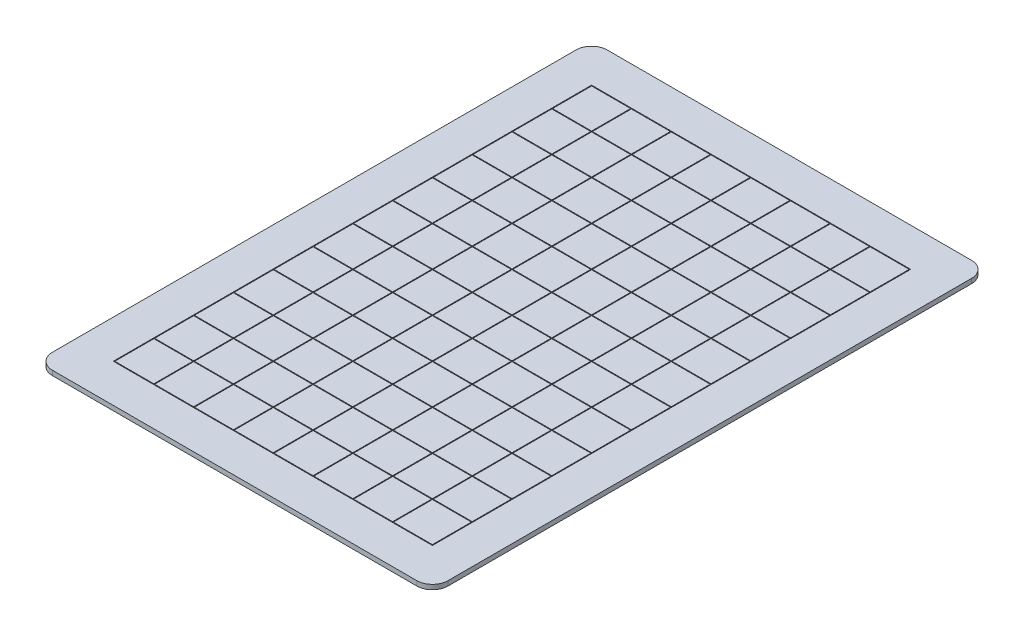
from build123d import *

# Parameters (mm, degrees)
SKETCH1_W           = 253.5
SKETCH1_H           = 355.5
BOSS_EXTRUDE1_DEPTH = 3
SKETCH2_W           = 204.5
SKETCH2_H           = 306.5
SKETCH2_W_2         = 25
SKETCH2_H_2         = 25
CUT_EXTRUDE1_DEPTH  = 0.5
SKETCH4_R           = 1.6
CUT_EXTRUDE2_DEPTH  = 1.2
FILLET1_R           = 10


with BuildPart() as part:
    # Sketch1 → Boss-Extrude1 (new body)
    with BuildSketch(Plane(origin=(0, 0, 0), x_dir=(1, 0, 0), z_dir=(0, 1, 0))):
        with Locations((126.75, 177.75)):
            Rectangle(SKETCH1_W, SKETCH1_H)
    extrude(amount=BOSS_EXTRUDE1_DEPTH)

    # Sketch2 → Cut-Extrude1 (cut)
    with BuildSketch(Plane(origin=(0, 3, 0), x_dir=(1, 0, 0), z_dir=(0, 1, 0))):
        with Locations((126.75, 177.75)):
            Rectangle(SKETCH2_W, SKETCH2_H)
        with Locations((37.5, 37.5)):
            Rectangle(SKETCH2_W_2, SKETCH2_H_2, mode=Mode.SUBTRACT)
        with Locations((63, 37.5)):
            Rectangle(SKETCH2_W_2, SKETCH2_H_2, mode=Mode.SUBTRACT)
        with Locations((88.5, 37.5)):
            Rectangle(SKETCH2_W_2, SKETCH2_H_2, mode=Mode.SUBTRACT)
        with Locations((114, 37.5)):
            Rectangle(SKETCH2_W_2, SKETCH2_H_2, mode=Mode.SUBTRACT)
        with Locations((139.5, 37.5)):
            Rectangle(SKETCH2_W_2, SKETCH2_H_2, mode=Mode.SUBTRACT)
        with Locations((165, 37.5)):
            Rectangle(SKETCH2_W_2, SKETCH2_H_2, mode=Mode.SUBTRACT)
        with Locations((190.5, 37.5)):
            Rectangle(SKETCH2_W_2, SKETCH2_H_2, mode=Mode.SUBTRACT)
        with Locations((216, 37.5)):
            Rectangle(SKETCH2_W_2, SKETCH2_H_2, mode=Mode.SUBTRACT)
        with Locations((63, 63)):
            Rectangle(SKETCH2_W_2, SKETCH2_H_2, mode=Mode.SUBTRACT)
        with Locations((88.5, 63)):
            Rectangle(SKETCH2_W_2, SKETCH2_H_2, mode=Mode.SUBTRACT)
        with Locations((114, 63)):
            Rectangle(SKETCH2_W_2, SKETCH2_H_2, mode=Mode.SUBTRACT)
        with Locations((139.5, 63)):
            Rectangle(SKETCH2_W_2, SKETCH2_H_2, mode=Mode.SUBTRACT)
        with Locations((165, 63)):
            Rectangle(SKETCH2_W_2, SKETCH2_H_2, mode=Mode.SUBTRACT)
        with Locations((190.5, 63)):
            Rectangle(SKETCH2_W_2, SKETCH2_H_2, mode=Mode.SUBTRACT)
        with Locations((216, 63)):
            Rectangle(SKETCH2_W_2, SKETCH2_H_2, mode=Mode.SUBTRACT)
        with Locations((63, 88.5)):
            Rectangle(SKETCH2_W_2, SKETCH2_H_2, mode=Mode.SUBTRACT)
        with Locations((88.5, 88.5)):
            Rectangle(SKETCH2_W_2, SKETCH2_H_2, mode=Mode.SUBTRACT)
        with Locations((114, 88.5)):
            Rectangle(SKETCH2_W_2, SKETCH2_H_2, mode=Mode.SUBTRACT)
        with Locations((139.5, 88.5)):
            Rectangle(SKETCH2_W_2, SKETCH2_H_2, mode=Mode.SUBTRACT)
        with Locations((165, 88.5)):
            Rectangle(SKETCH2_W_2, SKETCH2_H_2, mode=Mode.SUBTRACT)
        with Locations((190.5, 88.5)):
            Rectangle(SKETCH2_W_2, SKETCH2_H_2, mode=Mode.SUBTRACT)
        with Locations((216, 88.5)):
            Rectangle(SKETCH2_W_2, SKETCH2_H_2, mode=Mode.SUBTRACT)
        with Locations((63, 114)):
            Rectangle(SKETCH2_W_2, SKETCH2_H_2, mode=Mode.SUBTRACT)
        with Locations((88.5, 114)):
            Rectangle(SKETCH2_W_2, SKETCH2_H_2, mode=Mode.SUBTRACT)
        with Locations((114, 114)):
            Rectangle(SKETCH2_W_2, SKETCH2_H_2, mode=Mode.SUBTRACT)
        with Locations((139.5, 114)):
            Rectangle(SKETCH2_W_2, SKETCH2_H_2, mode=Mode.SUBTRACT)
        with Locations((165, 114)):
            Rectangle(SKETCH2_W_2, SKETCH2_H_2, mode=Mode.SUBTRACT)
        with Locations((190.5, 114)):
            Rectangle(SKETCH2_W_2, SKETCH2_H_2, mode=Mode.SUBTRACT)
        with Locations((216, 114)):
            Rectangle(SKETCH2_W_2, SKETCH2_H_2, mode=Mode.SUBTRACT)
        with Locations((63, 139.5)):
            Rectangle(SKETCH2_W_2, SKETCH2_H_2, mode=Mode.SUBTRACT)
        with Locations((88.5, 139.5)):
            Rectangle(SKETCH2_W_2, SKETCH2_H_2, mode=Mode.SUBTRACT)
        with Locations((114, 139.5)):
            Rectangle(SKETCH2_W_2, SKETCH2_H_2, mode=Mode.SUBTRACT)
        with Locations((139.5, 139.5)):
            Rectangle(SKETCH2_W_2, SKETCH2_H_2, mode=Mode.SUBTRACT)
        with Locations((165, 139.5)):
            Rectangle(SKETCH2_W_2, SKETCH2_H_2, mode=Mode.SUBTRACT)
        with Locations((190.5, 139.5)):
            Rectangle(SKETCH2_W_2, SKETCH2_H_2, mode=Mode.SUBTRACT)
        with Locations((216, 139.5)):
            Rectangle(SKETCH2_W_2, SKETCH2_H_2, mode=Mode.SUBTRACT)
        with Locations((63, 165)):
            Rectangle(SKETCH2_W_2, SKETCH2_H_2, mode=Mode.SUBTRACT)
        with Locations((88.5, 165)):
            Rectangle(SKETCH2_W_2, SKETCH2_H_2, mode=Mode.SUBTRACT)
        with Locations((114, 165)):
            Rectangle(SKETCH2_W_2, SKETCH2_H_2, mode=Mode.SUBTRACT)
        with Locations((139.5, 165)):
            Rectangle(SKETCH2_W_2, SKETCH2_H_2, mode=Mode.SUBTRACT)
        with Locations((165, 165)):
            Rectangle(SKETCH2_W_2, SKETCH2_H_2, mode=Mode.SUBTRACT)
        with Locations((190.5, 165)):
            Rectangle(SKETCH2_W_2, SKETCH2_H_2, mode=Mode.SUBTRACT)
        with Locations((216, 165)):
            Rectangle(SKETCH2_W_2, SKETCH2_H_2, mode=Mode.SUBTRACT)
        with Locations((63, 190.5)):
            Rectangle(SKETCH2_W_2, SKETCH2_H_2, mode=Mode.SUBTRACT)
        with Locations((88.5, 190.5)):
            Rectangle(SKETCH2_W_2, SKETCH2_H_2, mode=Mode.SUBTRACT)
        with Locations((114, 190.5)):
            Rectangle(SKETCH2_W_2, SKETCH2_H_2, mode=Mode.SUBTRACT)
        with Locations((139.5, 190.5)):
            Rectangle(SKETCH2_W_2, SKETCH2_H_2, mode=Mode.SUBTRACT)
        with Locations((165, 190.5)):
            Rectangle(SKETCH2_W_2, SKETCH2_H_2, mode=Mode.SUBTRACT)
        with Locations((190.5, 190.5)):
            Rectangle(SKETCH2_W_2, SKETCH2_H_2, mode=Mode.SUBTRACT)
        with Locations((216, 190.5)):
            Rectangle(SKETCH2_W_2, SKETCH2_H_2, mode=Mode.SUBTRACT)
        with Locations((63, 216)):
            Rectangle(SKETCH2_W_2, SKETCH2_H_2, mode=Mode.SUBTRACT)
        with Locations((88.5, 216)):
            Rectangle(SKETCH2_W_2, SKETCH2_H_2, mode=Mode.SUBTRACT)
        with Locations((114, 216)):
            Rectangle(SKETCH2_W_2, SKETCH2_H_2, mode=Mode.SUBTRACT)
        with Locations((139.5, 216)):
            Rectangle(SKETCH2_W_2, SKETCH2_H_2, mode=Mode.SUBTRACT)
        with Locations((165, 216)):
            Rectangle(SKETCH2_W_2, SKETCH2_H_2, mode=Mode.SUBTRACT)
        with Locations((190.5, 216)):
            Rectangle(SKETCH2_W_2, SKETCH2_H_2, mode=Mode.SUBTRACT)
        with Locations((216, 216)):
            Rectangle(SKETCH2_W_2, SKETCH2_H_2, mode=Mode.SUBTRACT)
        with Locations((63, 241.5)):
            Rectangle(SKETCH2_W_2, SKETCH2_H_2, mode=Mode.SUBTRACT)
        with Locations((88.5, 241.5)):
            Rectangle(SKETCH2_W_2, SKETCH2_H_2, mode=Mode.SUBTRACT)
        with Locations((114, 241.5)):
            Rectangle(SKETCH2_W_2, SKETCH2_H_2, mode=Mode.SUBTRACT)
        with Locations((139.5, 241.5)):
            Rectangle(SKETCH2_W_2, SKETCH2_H_2, mode=Mode.SUBTRACT)
        with Locations((165, 241.5)):
            Rectangle(SKETCH2_W_2, SKETCH2_H_2, mode=Mode.SUBTRACT)
        with Locations((190.5, 241.5)):
            Rectangle(SKETCH2_W_2, SKETCH2_H_2, mode=Mode.SUBTRACT)
        with Locations((216, 241.5)):
            Rectangle(SKETCH2_W_2, SKETCH2_H_2, mode=Mode.SUBTRACT)
        with Locations((63, 267)):
            Rectangle(SKETCH2_W_2, SKETCH2_H_2, mode=Mode.SUBTRACT)
        with Locations((88.5, 267)):
            Rectangle(SKETCH2_W_2, SKETCH2_H_2, mode=Mode.SUBTRACT)
        with Locations((114, 267)):
            Rectangle(SKETCH2_W_2, SKETCH2_H_2, mode=Mode.SUBTRACT)
        with Locations((139.5, 267)):
            Rectangle(SKETCH2_W_2, SKETCH2_H_2, mode=Mode.SUBTRACT)
        with Locations((165, 267)):
            Rectangle(SKETCH2_W_2, SKETCH2_H_2, mode=Mode.SUBTRACT)
        with Locations((190.5, 267)):
            Rectangle(SKETCH2_W_2, SKETCH2_H_2, mode=Mode.SUBTRACT)
        with Locations((216, 267)):
            Rectangle(SKETCH2_W_2, SKETCH2_H_2, mode=Mode.SUBTRACT)
        with Locations((63, 292.5)):
            Rectangle(SKETCH2_W_2, SKETCH2_H_2, mode=Mode.SUBTRACT)
        with Locations((88.5, 292.5)):
            Rectangle(SKETCH2_W_2, SKETCH2_H_2, mode=Mode.SUBTRACT)
        with Locations((114, 292.5)):
            Rectangle(SKETCH2_W_2, SKETCH2_H_2, mode=Mode.SUBTRACT)
        with Locations((139.5, 292.5)):
            Rectangle(SKETCH2_W_2, SKETCH2_H_2, mode=Mode.SUBTRACT)
        with Locations((165, 292.5)):
            Rectangle(SKETCH2_W_2, SKETCH2_H_2, mode=Mode.SUBTRACT)
        with Locations((190.5, 292.5)):
            Rectangle(SKETCH2_W_2, SKETCH2_H_2, mode=Mode.SUBTRACT)
        with Locations((216, 292.5)):
            Rectangle(SKETCH2_W_2, SKETCH2_H_2, mode=Mode.SUBTRACT)
        with Locations((63, 318)):
            Rectangle(SKETCH2_W_2, SKETCH2_H_2, mode=Mode.SUBTRACT)
        with Locations((88.5, 318)):
            Rectangle(SKETCH2_W_2, SKETCH2_H_2, mode=Mode.SUBTRACT)
        with Locations((114, 318)):
            Rectangle(SKETCH2_W_2, SKETCH2_H_2, mode=Mode.SUBTRACT)
        with Locations((139.5, 318)):
            Rectangle(SKETCH2_W_2, SKETCH2_H_2, mode=Mode.SUBTRACT)
        with Locations((165, 318)):
            Rectangle(SKETCH2_W_2, SKETCH2_H_2, mode=Mode.SUBTRACT)
        with Locations((190.5, 318)):
            Rectangle(SKETCH2_W_2, SKETCH2_H_2, mode=Mode.SUBTRACT)
        with Locations((216, 318)):
            Rectangle(SKETCH2_W_2, SKETCH2_H_2, mode=Mode.SUBTRACT)
        with Locations((37.5, 63)):
            Rectangle(SKETCH2_W_2, SKETCH2_H_2, mode=Mode.SUBTRACT)
        with Locations((37.5, 88.5)):
            Rectangle(SKETCH2_W_2, SKETCH2_H_2, mode=Mode.SUBTRACT)
        with Locations((37.5, 114)):
            Rectangle(SKETCH2_W_2, SKETCH2_H_2, mode=Mode.SUBTRACT)
        with Locations((37.5, 139.5)):
            Rectangle(SKETCH2_W_2, SKETCH2_H_2, mode=Mode.SUBTRACT)
        with Locations((37.5, 165)):
            Rectangle(SKETCH2_W_2, SKETCH2_H_2, mode=Mode.SUBTRACT)
        with Locations((37.5, 190.5)):
            Rectangle(SKETCH2_W_2, SKETCH2_H_2, mode=Mode.SUBTRACT)
        with Locations((37.5, 216)):
            Rectangle(SKETCH2_W_2, SKETCH2_H_2, mode=Mode.SUBTRACT)
        with Locations((37.5, 241.5)):
            Rectangle(SKETCH2_W_2, SKETCH2_H_2, mode=Mode.SUBTRACT)
        with Locations((37.5, 267)):
            Rectangle(SKETCH2_W_2, SKETCH2_H_2, mode=Mode.SUBTRACT)
        with Locations((37.5, 292.5)):
            Rectangle(SKETCH2_W_2, SKETCH2_H_2, mode=Mode.SUBTRACT)
        with Locations((37.5, 318)):
            Rectangle(SKETCH2_W_2, SKETCH2_H_2, mode=Mode.SUBTRACT)
    extrude(amount=-CUT_EXTRUDE1_DEPTH, mode=Mode.SUBTRACT)

    # Sketch4 → Cut-Extrude2 (cut)
    with BuildSketch(Plane.XZ):
        with Locations((6, -177.75)):
            Circle(SKETCH4_R)
        with Locations((247.5, -177.75)):
            Circle(SKETCH4_R)
        with Locations((6, -6)):
            Circle(SKETCH4_R)
        with Locations((6, -91.875)):
            Circle(SKETCH4_R)
        with Locations((6, -263.625)):
            Circle(SKETCH4_R)
        with Locations((6, -349.5)):
            Circle(SKETCH4_R)
        with Locations((247.5, -6)):
            Circle(SKETCH4_R)
        with Locations((247.5, -91.875)):
            Circle(SKETCH4_R)
        with Locations((247.5, -263.625)):
            Circle(SKETCH4_R)
        with Locations((86.5, -349.5)):
            Circle(SKETCH4_R)
        with Locations((167, -349.5)):
            Circle(SKETCH4_R)
        with Locations((247.5, -349.5)):
            Circle(SKETCH4_R)
        with Locations((167, -6)):
            Circle(SKETCH4_R)
        with Locations((86.5, -6)):
            Circle(SKETCH4_R)
    extrude(amount=-CUT_EXTRUDE2_DEPTH, mode=Mode.SUBTRACT)

    # Fillet1
    fillet1_edges = [part.edges().sort_by_distance(p)[0] for p in [
        (253.5, 1.5, 0),
        (0, 1.5, 0),
        (0, 1.5, -355.5),
        (253.5, 1.5, -355.5),
    ]]
    fillet(fillet1_edges, radius=FILLET1_R)


solid = part.part
